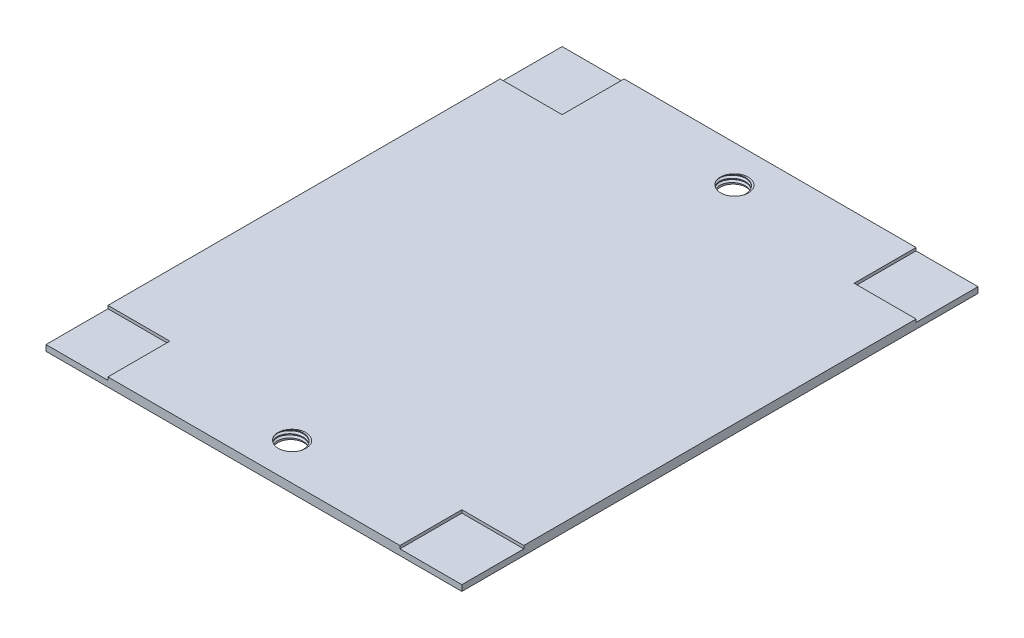
from build123d import *

# Parameters (mm, degrees)
SKETCH1_W           = 282
SKETCH1_H           = 350
BOSS_EXTRUDE1_DEPTH = 6
SKETCH2_W           = 42
SKETCH2_H           = 42
CUT_EXTRUDE1_DEPTH  = 2
SKETCH3_R           = 8.75
CUT_EXTRUDE2_DEPTH  = 10
THREAD1_PITCH       = 2.5
THREAD2_PITCH       = 2.5


with BuildPart() as part:
    # Sketch1 → Boss-Extrude1 (new body)
    with BuildSketch(Plane(origin=(0, 0, 0), x_dir=(1, 0, 0), z_dir=(0, 1, 0))):
        Rectangle(SKETCH1_W, SKETCH1_H)
    extrude(amount=BOSS_EXTRUDE1_DEPTH)

    # Sketch2 → Cut-Extrude1 (cut)
    with BuildSketch(Plane(origin=(0, 6, 0), x_dir=(1, 0, 0), z_dir=(0, 1, 0))):
        with Locations((-120, 154)):
            Rectangle(SKETCH2_W, SKETCH2_H)
        with Locations((120, 154)):
            Rectangle(SKETCH2_W, SKETCH2_H)
        with Locations((-120, -154)):
            Rectangle(SKETCH2_W, SKETCH2_H)
        with Locations((120, -154)):
            Rectangle(SKETCH2_W, SKETCH2_H)
    extrude(amount=-CUT_EXTRUDE1_DEPTH, mode=Mode.SUBTRACT)

    # Sketch3 → Cut-Extrude2 (cut)
    with BuildSketch(Plane(origin=(0, 6, 0), x_dir=(1, 0, 0), z_dir=(0, 1, 0))):
        with Locations(Location((0, 150, 0), (0, 0, 270))):
            Circle(SKETCH3_R)
        with Locations(Location((0, -150, 0), (0, 0, 270))):
            Circle(SKETCH3_R)
    extrude(amount=-CUT_EXTRUDE2_DEPTH, mode=Mode.SUBTRACT)

    # Thread1: the profile of Thread Profile2 profile screwed along a right-hand helix of 6 turns, 10 arcs to a turn; built about Z, then put on its axis
    thread1_z = Axis((0, 0, 0), (0, 0, 1))
    thread1_corners = [(8.7497, 0, -0.000173205), (10.103164687, 0, 0.781249997), (10.103164687, 0, 1.093749997), (8.7497, 0, 1.875173198)]
    with BuildLine(mode=Mode.PRIVATE) as thread1_profile:
        Line(thread1_corners[0], thread1_corners[1])
        Line(thread1_corners[1], thread1_corners[2])
        Line(thread1_corners[2], thread1_corners[3])
        Line(thread1_corners[3], thread1_corners[0])
    thread1_cap = Face(thread1_profile.wire())
    thread1_turn_angles = [0, 18, 36, 54, 72, 90, 108, 126, 144, 162, 180, 198, 216, 234, 252, 270, 288, 306, 324, 342, 360]
    thread1_turn_weights = [1, 0.9510565162951535, 1, 0.9510565162951535, 1, 0.9510565162951535, 1, 0.9510565162951535, 1, 0.9510565162951535, 1, 0.9510565162951535, 1, 0.9510565162951535, 1, 0.9510565162951535, 1, 0.9510565162951535, 1, 0.9510565162951535, 1]
    thread1_turn_rails = [Edge.make_bspline([Vector(p[0], p[1], 0).rotate(thread1_z, thread1_turn_angles[k]) / thread1_turn_weights[k] + Vector(0, 0, p[2] + THREAD1_PITCH * thread1_turn_angles[k] / 360) for k in range(21)], [0, 0, 0, 1, 1, 2, 2, 3, 3, 4, 4, 5, 5, 6, 6, 7, 7, 8, 8, 9, 9, 10, 10, 10], 2, thread1_turn_weights) for p in thread1_corners]
    thread1_turn_sides = [Face.make_surface_from_curves(thread1_turn_rails[p[0]], thread1_turn_rails[p[1]]) for p in [(0, 1), (1, 2), (2, 3), (3, 0)]]
    thread1 = Plane(origin=(0, 0, -150), x_dir=(1, 0, 0), z_dir=(0, 1, 0)) * Solid(Shell([*[p.moved(Location((0, 0, THREAD1_PITCH * i))) for i in range(6) for p in thread1_turn_sides], thread1_cap, thread1_cap.rotate(thread1_z, 2160).moved(Location((0, 0, THREAD1_PITCH * 2160 / 360)))]))
    add(thread1, mode=Mode.SUBTRACT)

    # Thread2: the profile of Thread Profile3 profile screwed along a right-hand helix of 6 turns, 10 arcs to a turn; built about Z, then put on its axis
    thread2_z = Axis((0, 0, 0), (0, 0, 1))
    thread2_corners = [(8.7497, 0, -0.000173205), (10.103164688, 0, 0.781249997), (10.103164688, 0, 1.093749997), (8.7497, 0, 1.875173198)]
    with BuildLine(mode=Mode.PRIVATE) as thread2_profile:
        Line(thread2_corners[0], thread2_corners[1])
        Line(thread2_corners[1], thread2_corners[2])
        Line(thread2_corners[2], thread2_corners[3])
        Line(thread2_corners[3], thread2_corners[0])
    thread2_cap = Face(thread2_profile.wire())
    thread2_turn_angles = [0, 18, 36, 54, 72, 90, 108, 126, 144, 162, 180, 198, 216, 234, 252, 270, 288, 306, 324, 342, 360]
    thread2_turn_weights = [1, 0.9510565162951535, 1, 0.9510565162951535, 1, 0.9510565162951535, 1, 0.9510565162951535, 1, 0.9510565162951535, 1, 0.9510565162951535, 1, 0.9510565162951535, 1, 0.9510565162951535, 1, 0.9510565162951535, 1, 0.9510565162951535, 1]
    thread2_turn_rails = [Edge.make_bspline([Vector(p[0], p[1], 0).rotate(thread2_z, thread2_turn_angles[k]) / thread2_turn_weights[k] + Vector(0, 0, p[2] + THREAD2_PITCH * thread2_turn_angles[k] / 360) for k in range(21)], [0, 0, 0, 1, 1, 2, 2, 3, 3, 4, 4, 5, 5, 6, 6, 7, 7, 8, 8, 9, 9, 10, 10, 10], 2, thread2_turn_weights) for p in thread2_corners]
    thread2_turn_sides = [Face.make_surface_from_curves(thread2_turn_rails[p[0]], thread2_turn_rails[p[1]]) for p in [(0, 1), (1, 2), (2, 3), (3, 0)]]
    thread2 = Plane(origin=(0, 0, 150), x_dir=(1, 0, 0), z_dir=(0, 1, 0)) * Solid(Shell([*[p.moved(Location((0, 0, THREAD2_PITCH * i))) for i in range(6) for p in thread2_turn_sides], thread2_cap, thread2_cap.rotate(thread2_z, 2160).moved(Location((0, 0, THREAD2_PITCH * 2160 / 360)))]))
    add(thread2, mode=Mode.SUBTRACT)


solid = part.part
